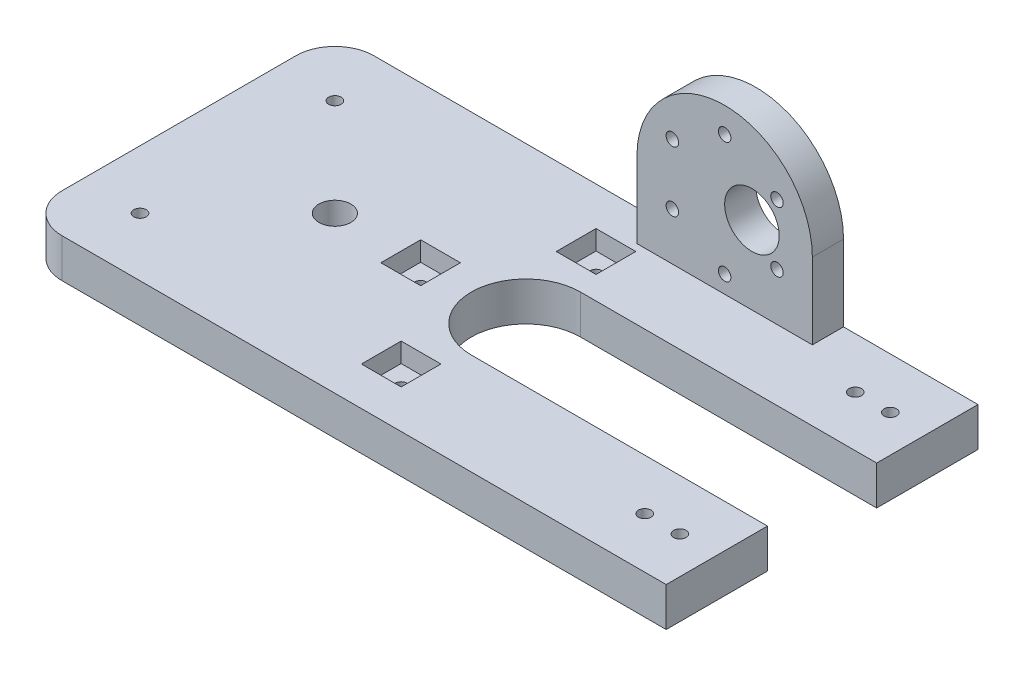
from build123d import *

# Parameters (mm, degrees)
SKETCH_1_R          = 4.1
EXTRUDE_1_DEPTH     = 10
FILLET_1_R          = 10
FILLET_2_R          = 14
SKETCH_5_W          = 45
SKETCH_5_H          = 8
EXTRUDE_4_DEPTH     = 42
FILLET_3_RADIUS     = 22.5
FILLET_3_LENGTH     = 8
SKETCH_6_R          = 7
SKETCH_6_R_2        = 1.6
CUT_EXTRUDE_1_DEPTH = 122.21984161
SKETCH_7_W          = 10.2
SKETCH_7_H          = 10.2
CUT_EXTRUDE_2_DEPTH = 5
SKETCH_8_R          = 1.6
CUT_EXTRUDE_3_DEPTH = 101.847657385
SKETCH_2_R          = 1.6
CUT_EXTRUDE_5_DEPTH = 101.847657385
CUT_EXTRUDE_6_REACH = 107.405
SKETCH_9_R          = 1.5
SKETCH_10_R         = 3
CUT_EXTRUDE_7_DEPTH = 2


with BuildPart() as part:
    # ｽｹｯﾁ1 → ﾎﾞｽ - 押し出し1 (new body)
    with BuildSketch(Plane(origin=(0, 0, 0), x_dir=(1, 0, 0), z_dir=(0, 1, 0))):
        Polygon((82.5, 14), (82.5, 40), (-82.5, 40), (-82.5, -40), (82.5, -40), (82.5, -14), (-7.5, -14), (-7.5, 14), align=None)
        with Locations(Location((-42.5, 0, 0), (0, 0, 270))):
            Circle(SKETCH_1_R, mode=Mode.SUBTRACT)
    extrude(amount=EXTRUDE_1_DEPTH)

    # ﾌｨﾚｯﾄ1
    fillet_1_edges = [part.edges().sort_by_distance(p)[0] for p in [
        (-82.5, 5, 40),
        (-82.5, 5, -40),
    ]]
    fillet(fillet_1_edges, radius=FILLET_1_R)

    # ﾌｨﾚｯﾄ2
    fillet_2_edges = [part.edges().sort_by_distance(p)[0] for p in [
        (-7.5, 5, -14),
        (-7.5, 5, 14),
    ]]
    fillet(fillet_2_edges, radius=FILLET_2_R - 0.0001)  # a hair under: the kernel refuses the full size

    # ｽｹｯﾁ5 → ﾎﾞｽ - 押し出し4 (add)
    with BuildSketch(Plane(origin=(0, 10, 0), x_dir=(1, 0, 0), z_dir=(0, 1, 0))):
        with Locations((25.5, 36)):
            Rectangle(SKETCH_5_W, SKETCH_5_H)
    extrude(amount=EXTRUDE_4_DEPTH)

    # ﾌｨﾚｯﾄ3: full round fillet: the end face becomes a half cylinder, R = half its width
    fillet_3_face = Plane((25.5, 52, -36), x_dir=(0, 0, -1), z_dir=(0, 1, 0))  # on the end face: x along it, z out of the body
    fillet_3_slab = fillet_3_face.offset(-FILLET_3_RADIUS / 2) * Box(FILLET_3_LENGTH, 2 * FILLET_3_RADIUS, FILLET_3_RADIUS, mode=Mode.PRIVATE)  # the body's end, R deep
    fillet_3_round = Plane((25.5, 29.5, -36), x_dir=(0, 1, 0), z_dir=(0, 0, -1)) * Cylinder(FILLET_3_RADIUS, FILLET_3_LENGTH, mode=Mode.PRIVATE)  # its axis R under the face
    add(fillet_3_slab - fillet_3_round, mode=Mode.SUBTRACT)

    # ｽｹｯﾁ6 → ｶｯﾄ - 押し出し1 (cut, through all)
    with BuildSketch(Plane.XY.offset(-32)):
        with Locations((32.5, 30)):
            Circle(SKETCH_6_R)
        with Locations((25.5, 45.5)):
            Circle(SKETCH_6_R_2)
        with Locations((38.923393759, 37.75)):
            Circle(SKETCH_6_R_2)
        with Locations((38.923393759, 22.25)):
            Circle(SKETCH_6_R_2)
        with Locations((25.5, 14.5)):
            Circle(SKETCH_6_R_2)
        with Locations((12.076606241, 22.25)):
            Circle(SKETCH_6_R_2)
        with Locations((12.076606241, 37.75)):
            Circle(SKETCH_6_R_2)
    extrude(amount=-CUT_EXTRUDE_1_DEPTH, mode=Mode.SUBTRACT)

    # ｽｹｯﾁ7 → ｶｯﾄ - 押し出し2 (cut)
    with BuildSketch(Plane(origin=(0, 10, 0), x_dir=(1, 0, 0), z_dir=(0, 1, 0))):
        with Locations((-0.5, 25)):
            Rectangle(SKETCH_7_W, SKETCH_7_H)
        with Locations((-0.5, -25)):
            Rectangle(SKETCH_7_W, SKETCH_7_H)
        with Locations((-20.5, 0)):
            Rectangle(SKETCH_7_W, SKETCH_7_H)
    extrude(amount=-CUT_EXTRUDE_2_DEPTH, mode=Mode.SUBTRACT)

    # ｽｹｯﾁ8 → ｶｯﾄ - 押し出し3 (cut, through all)
    with BuildSketch(Plane(origin=(0, 10, 0), x_dir=(1, 0, 0), z_dir=(0, 1, 0))):
        with Locations(Location((73, 27, 0), (0, 0, 270))):
            Circle(SKETCH_8_R)
        with Locations(Location((64, 27, 0), (0, 0, 270))):
            Circle(SKETCH_8_R)
        with Locations(Location((64, -27, 0), (0, 0, 270))):
            Circle(SKETCH_8_R)
        with Locations(Location((73, -27, 0), (0, 0, 270))):
            Circle(SKETCH_8_R)
    extrude(amount=-CUT_EXTRUDE_3_DEPTH, mode=Mode.SUBTRACT)

    # ｽｹｯﾁ2 → ｶｯﾄ - 押し出し5 (cut, through all)
    with BuildSketch(Plane(origin=(0, 10, 0), x_dir=(1, 0, 0), z_dir=(0, 1, 0))):
        with Locations(Location((-67.5, 25, 0), (0, 0, 270))):
            Circle(SKETCH_2_R)
        with Locations(Location((-67.5, -25, 0), (0, 0, 270))):
            Circle(SKETCH_2_R)
    extrude(amount=-CUT_EXTRUDE_5_DEPTH, mode=Mode.SUBTRACT)

    # ｽｹｯﾁ9 → ｶｯﾄ - 押し出し6 (cut, up to next)
    with BuildSketch(Plane(origin=(0, 0, 0), x_dir=(1, 0, 0), z_dir=(0, 1, 0)), mode=Mode.PRIVATE) as cut_extrude_6_sk1:
        with Locations(Location((-0.5, 25, 0), (0, 0, 270))):
            Circle(SKETCH_9_R)
    cut_extrude_6_tool1 = extrude(cut_extrude_6_sk1.sketch, amount=CUT_EXTRUDE_6_REACH, mode=Mode.PRIVATE) & part.part
    # ｽｹｯﾁ9 → ｶｯﾄ - 押し出し6 (cut, up to next)
    with BuildSketch(Plane(origin=(0, 0, 0), x_dir=(1, 0, 0), z_dir=(0, 1, 0)), mode=Mode.PRIVATE) as cut_extrude_6_sk2:
        with Locations(Location((-20.5, 0, 0), (0, 0, 90))):
            Circle(SKETCH_9_R)
    cut_extrude_6_tool2 = extrude(cut_extrude_6_sk2.sketch, amount=CUT_EXTRUDE_6_REACH, mode=Mode.PRIVATE) & part.part
    # ｽｹｯﾁ9 → ｶｯﾄ - 押し出し6 (cut, up to next)
    with BuildSketch(Plane(origin=(0, 0, 0), x_dir=(1, 0, 0), z_dir=(0, 1, 0)), mode=Mode.PRIVATE) as cut_extrude_6_sk3:
        with Locations(Location((-0.5, -25, 0), (0, 0, 270))):
            Circle(SKETCH_9_R)
    cut_extrude_6_tool3 = extrude(cut_extrude_6_sk3.sketch, amount=CUT_EXTRUDE_6_REACH, mode=Mode.PRIVATE) & part.part
    add(cut_extrude_6_tool1.solids().sort_by_distance((-0.5, 0, -25))[0], mode=Mode.SUBTRACT)
    add(cut_extrude_6_tool2.solids().sort_by_distance((-20.5, 0, 0))[0], mode=Mode.SUBTRACT)
    add(cut_extrude_6_tool3.solids().sort_by_distance((-0.5, 0, 25))[0], mode=Mode.SUBTRACT)

    # ｽｹｯﾁ10 → ｶｯﾄ - 押し出し7 (cut)
    with BuildSketch(Plane.XZ):
        with Locations(Location((-0.5, 25, 0), (0, 0, 270))):
            Circle(SKETCH_10_R)
        with Locations(Location((-20.5, 0, 0), (0, 0, 270))):
            Circle(SKETCH_10_R)
        with Locations(Location((-0.5, -25, 0), (0, 0, 270))):
            Circle(SKETCH_10_R)
        Polygon((-67.5, 28.1), (-70.184678752, 26.55), (-70.184678752, 23.45), (-67.5, 21.9), (-64.815321248, 23.45), (-64.815321248, 26.55), align=None)
        Polygon((-67.5, -21.9), (-70.184678752, -23.45), (-70.184678752, -26.55), (-67.5, -28.1), (-64.815321248, -26.55), (-64.815321248, -23.45), align=None)
    extrude(amount=-CUT_EXTRUDE_7_DEPTH, mode=Mode.SUBTRACT)


solid = part.part
